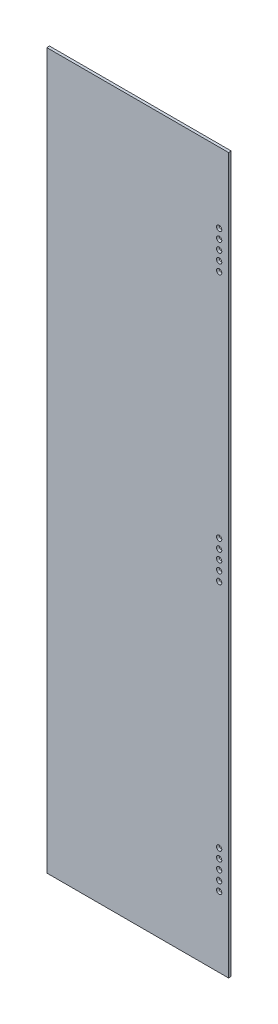
from build123d import *

# Parameters (mm, degrees)
SKETCH1_W            = 155
SKETCH1_H            = 609.6
BOSS_EXTRUDE1_DEPTH  = 2.305
M4_CLEARANCE_HOLE1_D = 4.5


with BuildPart() as part:
    # Sketch1 → Boss-Extrude1 (new body)
    with BuildSketch(Plane.XY):
        Rectangle(SKETCH1_W, SKETCH1_H)
    extrude(amount=BOSS_EXTRUDE1_DEPTH)

    # M4 Clearance Hole1 (through all)
    with Locations(Plane.XY.offset(2.305)):
        with Locations((69.5, 228.8), (69.5, 244.8), (69.5, 236.8), (69.5, 220.8), (69.5, 212.8), (69.5, 16), (69.5, 8), (69.5, 0), (69.5, -8), (69.5, -16), (69.5, -212.8), (69.5, -220.8), (69.5, -228.8), (69.5, -236.8), (69.5, -244.8)):
            Hole(M4_CLEARANCE_HOLE1_D / 2)


solid = part.part
